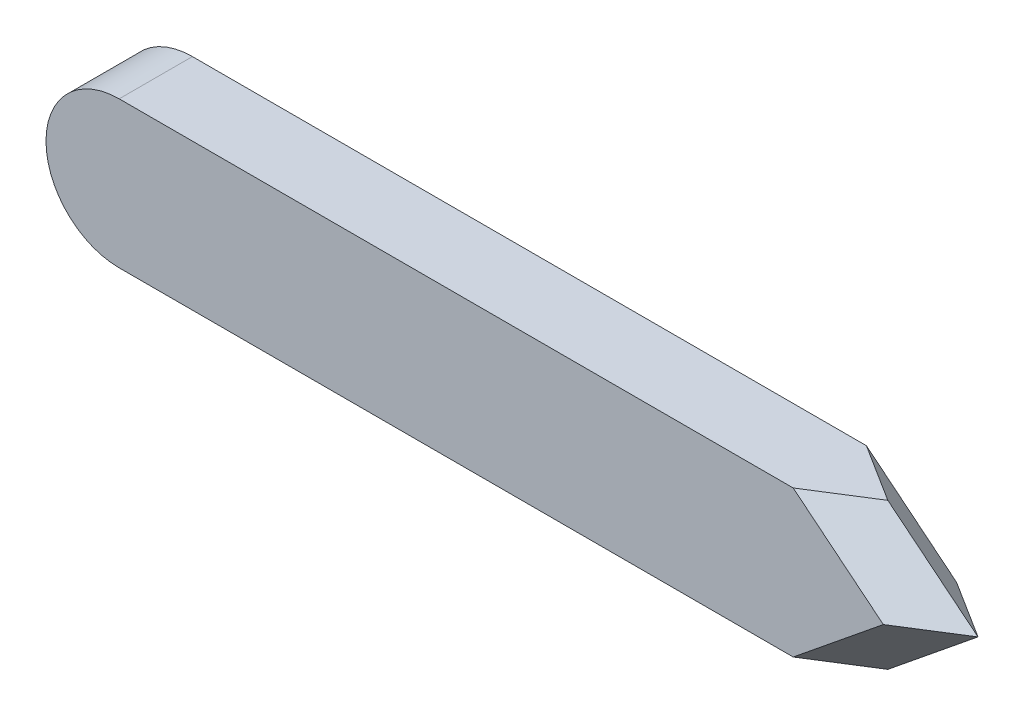
from build123d import *

# Parameters (mm, degrees)
EXTRUDE_1_DEPTH     = 4
SKETCH_2_R          = 2.6
CUT_EXTRUDE_1_DEPTH = 2.2
CHAMFER_2_SIZE      = 2


with BuildPart() as part:
    # 草图1 → 凸台-拉伸1 (new body)
    with BuildSketch(Plane.XY):
        with BuildLine():
            Line((0, 4), (40, 4))
            Line((40, 4), (44.926117642, 0))
            Line((44.926117642, 0), (40, -4))
            Line((40, -4), (0, -4))
            ThreePointArc((0, -4), (-4, 0), (0, 4))
        make_face()
    extrude(amount=EXTRUDE_1_DEPTH)

    # 草图2 → 切除-拉伸1 (cut)
    with BuildSketch(Plane(origin=(0, 0, 0), x_dir=(-1, 0, 0), z_dir=(0, 0, -1))):
        Circle(SKETCH_2_R)
    extrude(amount=-CUT_EXTRUDE_1_DEPTH, mode=Mode.SUBTRACT)

    # 倒角2
    chamfer_2_edges = [part.edges().sort_by_distance(p)[0] for p in [
        (42.463058821, -2, 0),
        (42.463058821, 2, 0),
        (42.463058821, -2, 4),
        (42.463058821, 2, 4),
    ]]
    chamfer(chamfer_2_edges, length=CHAMFER_2_SIZE - 0.0001)  # a hair under: the kernel refuses the full size


solid = part.part
